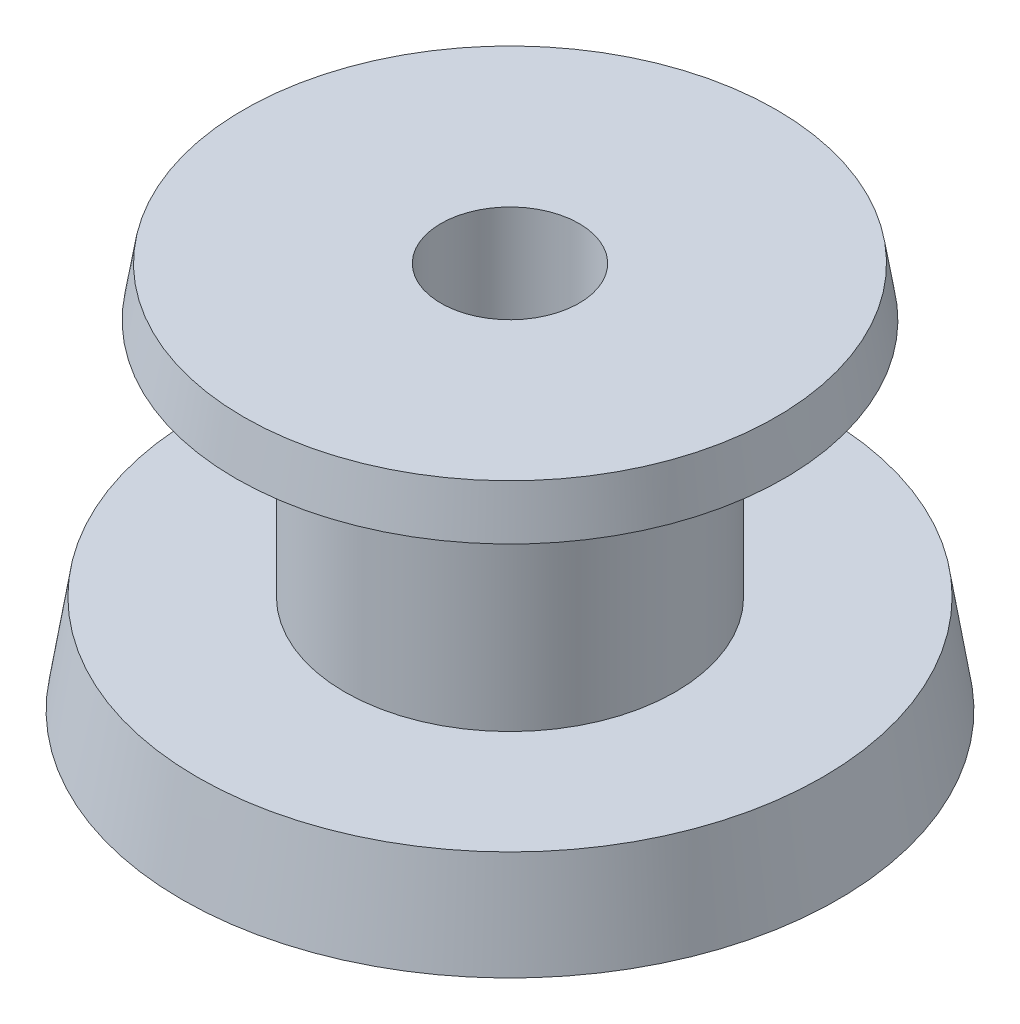
from build123d import *

# Parameters (mm, degrees)
SKETCH4_W                                            = 83.533222379
SKETCH4_H                                            = 117.210352631
CUT_EXTRUDE2_DEPTH                                   = 87.376
SKETCH5_W                                            = 27.522537574
SKETCH5_H                                            = 23.027433275
SKETCH5_W_2                                          = 149.909212054
SKETCH5_H_2                                          = 391.8
CUT_EXTRUDE3_DEPTH                                   = 50.8
CBORE_FOR_1_4_BINDING_HEAD_MACHINE_SCREW_D           = 7.14248
CBORE_FOR_1_4_BINDING_HEAD_MACHINE_SCREW_DEPTH       = 37.592
CBORE_FOR_1_4_BINDING_HEAD_MACHINE_SCREW_CBORE_D     = 21.9075
CBORE_FOR_1_4_BINDING_HEAD_MACHINE_SCREW_CBORE_DEPTH = 4.191
CBORE_FOR_1_4_BINDING_HEAD_MACHINE_SCREW_TIP         = 2.145817477


# Read off the part's stored shape, not the designer's step: Shell2, Surface-Fill9
with BuildPart() as part:
    # Sketch2 → Revolve1 (revolve)
    with BuildSketch(Plane.XY):
        with BuildLine():
            ThreePointArc((-51.054, 0), (-38.258433103, 255.279509027), (0, 508))
            Line((0, 508), (0, 0))
            Line((0, 0), (-51.054, 0))
        make_face()
    revolve(axis=Axis((0, 0, 0), (0, 1, 0)))

    # Shell2 outline → Shell2 (revolve, cut)
    with BuildSketch(Plane.XY):
        with BuildLine():
            add(Edge.make_bspline(
                [(0, 488.493083776), (47.244, 246.531114188), (47.244, 0)],
                knots=[6.090357515, 6.090357515, 6.090357515, 6.283185307, 6.283185307, 6.283185307], degree=2, weights=[1, 0.99535578, 1]))
            Line((0, 488.493083776), (0, 0))
            Line((0, 0), (47.244, 0))
        make_face()
    revolve(axis=Axis((0, 0, 0), (0, 1, 0)), mode=Mode.SUBTRACT)

    # Sketch4 → Cut-Extrude2 (cut, symmetric)
    with BuildSketch(Plane(origin=(0, 0, 0), x_dir=(0, 0, -1), z_dir=(1, 0, 0))):
        with Locations((-2.96538755, 490.405176316)):
            Rectangle(SKETCH4_W, SKETCH4_H)
    extrude(amount=CUT_EXTRUDE2_DEPTH, both=True, mode=Mode.SUBTRACT)


with BuildPart() as body_2:
    # Surface-Fill9 outline → Surface-Fill9 (revolve)
    with BuildSketch(Plane.XY):
        with BuildLine():
            Line((0, 0), (47.244, 0))
            ThreePointArc((47.244, 0), (38.017691062, 216.684281379), (10.405552869, 431.8))
            Line((10.405552869, 431.8), (0, 431.8))
            Line((0, 431.8), (0, 0))
        make_face()
    revolve(axis=Axis((0, 0, 0), (0, 1, 0)))

    # Sketch5 → Cut-Extrude3 (cut, symmetric)
    with BuildSketch(Plane.XY):
        with Locations((0, 423.313716638)):
            Rectangle(SKETCH5_W, SKETCH5_H)
        with Locations((0, 195.9)):
            Rectangle(SKETCH5_W_2, SKETCH5_H_2)
    extrude(amount=CUT_EXTRUDE3_DEPTH, both=True, mode=Mode.SUBTRACT)

    # CBORE for 1/4 Binding Head Machine Screw1
    with Locations(Plane(origin=(0, 391.8, 0), x_dir=(-1, 0, 0), z_dir=(0, -1, 0))):
        with Locations((0, 0)):
            CounterBoreHole(CBORE_FOR_1_4_BINDING_HEAD_MACHINE_SCREW_D / 2, CBORE_FOR_1_4_BINDING_HEAD_MACHINE_SCREW_CBORE_D / 2, CBORE_FOR_1_4_BINDING_HEAD_MACHINE_SCREW_CBORE_DEPTH, depth=CBORE_FOR_1_4_BINDING_HEAD_MACHINE_SCREW_DEPTH)
            with Locations((0, 0, -(CBORE_FOR_1_4_BINDING_HEAD_MACHINE_SCREW_DEPTH + CBORE_FOR_1_4_BINDING_HEAD_MACHINE_SCREW_TIP / 2))):  # 118° drill point
                Cone(0, CBORE_FOR_1_4_BINDING_HEAD_MACHINE_SCREW_D / 2, CBORE_FOR_1_4_BINDING_HEAD_MACHINE_SCREW_TIP, mode=Mode.SUBTRACT)

    # Sketch12 → Cut-Revolve5 (revolve, cut)
    with BuildSketch(Plane(origin=(0, 0, 0), x_dir=(0, 0, -1), z_dir=(1, 0, 0))):
        Polygon((-14.175746987, 409.26), (-16.158265967, 396.88), (-8.538265967, 396.88), (-8.538265967, 409.26), align=None)
    revolve(axis=Axis((0, 412.191202115, 0), (0, 1, 0)), mode=Mode.SUBTRACT)


with BuildPart() as cut_revolve5_kept_piece:
    # of the separate pieces the step leaves, the one the design keeps (cut_revolve5_pieces_kept)
    add(body_2.part.solids().sort_by_distance((16.953712849, 391.8, 0))[0])


solid = cut_revolve5_kept_piece.part
